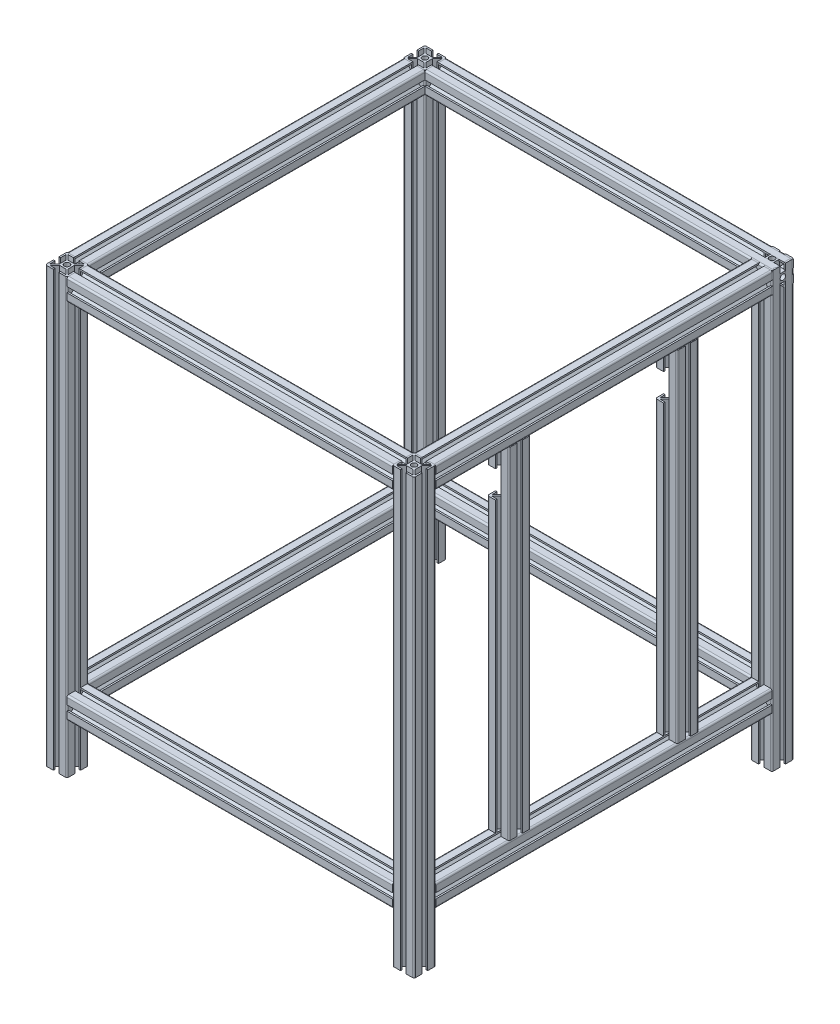
from build123d import *

# Parameters (mm, degrees)
ALUMINIUM_START                         = 20
ALUMINIUM_EXTRUSION_2020_1_OUTLINE_R    = 2.5
ALUMINIUM_EXTRUSION_2020_1_DEPTH        = 300
ALUMINIUM_EXTRUSION_2020_1_2_OUTLINE_R  = 2.5
ALUMINIUM_EXTRUSION_2020_1_2_DEPTH      = 310
ALUMINIUM_EXTRUSION_2020_1_3_OUTLINE_R  = 2.5
ALUMINIUM_EXTRUSION_2020_1_3_DEPTH      = 320
ALUMINIUM_EXTRUSION_2020_1_4_OUTLINE_R  = 2.5
ALUMINIUM_EXTRUSION_2020_1_4_DEPTH      = 310
ALUMINIUM_EXTRUSION_2020_1_5_OUTLINE_R  = 2.5
ALUMINIUM_EXTRUSION_2020_1_5_DEPTH      = 300
ALUMINIUM_EXTRUSION_2020_1_6_OUTLINE_R  = 2.5
ALUMINIUM_EXTRUSION_2020_1_6_DEPTH      = 310
ALUMINIUM_EXTRUSION_2020_1_7_OUTLINE_R  = 2.5
ALUMINIUM_EXTRUSION_2020_1_7_DEPTH      = 310
ALUMINIUM_EXTRUSION_2020_1_8_OUTLINE_R  = 2.5
ALUMINIUM_EXTRUSION_2020_1_8_DEPTH      = 300
ALUMINIUM_START_2                       = 66
ALUMINIUM_EXTRUSION_2020_1_9_OUTLINE_R  = 2.5
ALUMINIUM_EXTRUSION_2020_1_9_DEPTH      = 314
ALUMINIUM_EXTRUSION_2020_1_10_OUTLINE_R = 2.5
ALUMINIUM_EXTRUSION_2020_1_10_DEPTH     = 314
ALUMINIUM_EXTRUSION_2020_1_11_OUTLINE_R = 2.5
ALUMINIUM_EXTRUSION_2020_1_11_DEPTH     = 400
ALUMINIUM_EXTRUSION_2020_1_12_OUTLINE_R = 2.5
ALUMINIUM_EXTRUSION_2020_1_12_DEPTH     = 400
ALUMINIUM_EXTRUSION_2020_1_13_OUTLINE_R = 2.5
ALUMINIUM_EXTRUSION_2020_1_13_DEPTH     = 400
ALUMINIUM_EXTRUSION_2020_1_14_OUTLINE_R = 2.5
ALUMINIUM_EXTRUSION_2020_1_14_DEPTH     = 400
SKETCH2_W                               = 195.443565415
SKETCH2_H                               = 25
CUT_EXTRUDE1_DEPTH                      = 10


# Read off the part's stored shape, not the designer's step: Aluminium extrusion 2020(1)
with BuildPart() as part:
    # Aluminium extrusion 2020(1) outline → Aluminium extrusion 2020(1) (new body)
    with BuildSketch(Plane.YZ.offset(ALUMINIUM_START)):
        with BuildLine():
            Line((400, 331.5), (400, 337.5))
            Line((400, 337.5), (398.5, 337.5))
            Line((398.5, 337.5), (398.5, 332.560660172))
            Line((398.5, 332.560660172), (394, 337.060660172))
            Line((394, 337.060660172), (394, 342.939339828))
            Line((394, 342.939339828), (398.5, 347.439339828))
            Line((398.5, 347.439339828), (398.5, 342.5))
            Line((398.5, 342.5), (400, 342.5))
            Line((400, 342.5), (400, 348.5))
            ThreePointArc((400, 348.5), (399.560660172, 349.560660172), (398.5, 350))
            Line((398.5, 350), (392.5, 350))
            Line((392.5, 350), (392.5, 348.5))
            Line((392.5, 348.5), (397.439339828, 348.5))
            Line((397.439339828, 348.5), (392.939339828, 344))
            Line((392.939339828, 344), (387.060660172, 344))
            Line((387.060660172, 344), (382.560660172, 348.5))
            Line((382.560660172, 348.5), (387.5, 348.5))
            Line((387.5, 348.5), (387.5, 350))
            Line((387.5, 350), (381.5, 350))
            ThreePointArc((381.5, 350), (380.439339828, 349.560660172), (380, 348.5))
            Line((380, 348.5), (380, 342.5))
            Line((380, 342.5), (381.5, 342.5))
            Line((381.5, 342.5), (381.5, 347.439339828))
            Line((381.5, 347.439339828), (386, 342.939339828))
            Line((386, 342.939339828), (386, 337.060660172))
            Line((386, 337.060660172), (381.5, 332.560660172))
            Line((381.5, 332.560660172), (381.5, 337.5))
            Line((381.5, 337.5), (380, 337.5))
            Line((380, 337.5), (380, 331.5))
            ThreePointArc((380, 331.5), (380.439339828, 330.439339828), (381.5, 330))
            Line((381.5, 330), (387.5, 330))
            Line((387.5, 330), (387.5, 331.5))
            Line((387.5, 331.5), (382.560660172, 331.5))
            Line((382.560660172, 331.5), (387.060660172, 336))
            Line((387.060660172, 336), (392.939339828, 336))
            Line((392.939339828, 336), (397.439339828, 331.5))
            Line((397.439339828, 331.5), (392.5, 331.5))
            Line((392.5, 331.5), (392.5, 330))
            Line((392.5, 330), (398.5, 330))
            ThreePointArc((398.5, 330), (399.560660172, 330.439339828), (400, 331.5))
        make_face()
        with Locations((390, 340)):
            Circle(ALUMINIUM_EXTRUSION_2020_1_OUTLINE_R, mode=Mode.SUBTRACT)
    extrude(amount=ALUMINIUM_EXTRUSION_2020_1_DEPTH)


with BuildPart() as body_2:
    # Aluminium extrusion 2020_1 2 outline → Aluminium extrusion 2020_1 2 (new body)
    with BuildSketch(Plane.XY.offset(ALUMINIUM_START)):
        with BuildLine():
            Line((18.5, 400), (12.5, 400))
            Line((12.5, 400), (12.5, 398.5))
            Line((12.5, 398.5), (17.439339828, 398.5))
            Line((17.439339828, 398.5), (12.939339828, 394))
            Line((12.939339828, 394), (7.060660172, 394))
            Line((7.060660172, 394), (2.560660172, 398.5))
            Line((2.560660172, 398.5), (7.5, 398.5))
            Line((7.5, 398.5), (7.5, 400))
            Line((7.5, 400), (1.5, 400))
            ThreePointArc((1.5, 400), (0.439339828, 399.560660172), (0, 398.5))
            Line((0, 398.5), (0, 392.5))
            Line((0, 392.5), (1.5, 392.5))
            Line((1.5, 392.5), (1.5, 397.439339828))
            Line((1.5, 397.439339828), (6, 392.939339828))
            Line((6, 392.939339828), (6, 387.060660172))
            Line((6, 387.060660172), (1.5, 382.560660172))
            Line((1.5, 382.560660172), (1.5, 387.5))
            Line((1.5, 387.5), (0, 387.5))
            Line((0, 387.5), (0, 381.5))
            ThreePointArc((0, 381.5), (0.439339828, 380.439339828), (1.5, 380))
            Line((1.5, 380), (7.5, 380))
            Line((7.5, 380), (7.5, 381.5))
            Line((7.5, 381.5), (2.560660172, 381.5))
            Line((2.560660172, 381.5), (7.060660172, 386))
            Line((7.060660172, 386), (12.939339828, 386))
            Line((12.939339828, 386), (17.439339828, 381.5))
            Line((17.439339828, 381.5), (12.5, 381.5))
            Line((12.5, 381.5), (12.5, 380))
            Line((12.5, 380), (18.5, 380))
            ThreePointArc((18.5, 380), (19.560660172, 380.439339828), (20, 381.5))
            Line((20, 381.5), (20, 387.5))
            Line((20, 387.5), (18.5, 387.5))
            Line((18.5, 387.5), (18.5, 382.560660172))
            Line((18.5, 382.560660172), (14, 387.060660172))
            Line((14, 387.060660172), (14, 392.939339828))
            Line((14, 392.939339828), (18.5, 397.439339828))
            Line((18.5, 397.439339828), (18.5, 392.5))
            Line((18.5, 392.5), (20, 392.5))
            Line((20, 392.5), (20, 398.5))
            ThreePointArc((20, 398.5), (19.560660172, 399.560660172), (18.5, 400))
        make_face()
        with Locations((10, 390)):
            Circle(ALUMINIUM_EXTRUSION_2020_1_2_OUTLINE_R, mode=Mode.SUBTRACT)
    extrude(amount=ALUMINIUM_EXTRUSION_2020_1_2_DEPTH)


with BuildPart() as body_3:
    # Aluminium extrusion 2020_1 3 outline → Aluminium extrusion 2020_1 3 (new body)
    with BuildSketch(Plane.YZ.offset(ALUMINIUM_START)):
        with BuildLine():
            Line((400, 12.5), (400, 18.5))
            ThreePointArc((400, 18.5), (399.560660172, 19.560660172), (398.5, 20))
            Line((398.5, 20), (392.5, 20))
            Line((392.5, 20), (392.5, 18.5))
            Line((392.5, 18.5), (397.439339828, 18.5))
            Line((397.439339828, 18.5), (392.939339828, 14))
            Line((392.939339828, 14), (387.060660172, 14))
            Line((387.060660172, 14), (382.560660172, 18.5))
            Line((382.560660172, 18.5), (387.5, 18.5))
            Line((387.5, 18.5), (387.5, 20))
            Line((387.5, 20), (381.5, 20))
            ThreePointArc((381.5, 20), (380.439339828, 19.560660172), (380, 18.5))
            Line((380, 18.5), (380, 12.5))
            Line((380, 12.5), (381.5, 12.5))
            Line((381.5, 12.5), (381.5, 17.439339828))
            Line((381.5, 17.439339828), (386, 12.939339828))
            Line((386, 12.939339828), (386, 7.060660172))
            Line((386, 7.060660172), (381.5, 2.560660172))
            Line((381.5, 2.560660172), (381.5, 7.5))
            Line((381.5, 7.5), (380, 7.5))
            Line((380, 7.5), (380, 1.5))
            ThreePointArc((380, 1.5), (380.439339828, 0.439339828), (381.5, 0))
            Line((381.5, 0), (387.5, 0))
            Line((387.5, 0), (387.5, 1.5))
            Line((387.5, 1.5), (382.560660172, 1.5))
            Line((382.560660172, 1.5), (387.060660172, 6))
            Line((387.060660172, 6), (392.939339828, 6))
            Line((392.939339828, 6), (397.439339828, 1.5))
            Line((397.439339828, 1.5), (392.5, 1.5))
            Line((392.5, 1.5), (392.5, 0))
            Line((392.5, 0), (398.5, 0))
            ThreePointArc((398.5, 0), (399.560660172, 0.439339828), (400, 1.5))
            Line((400, 1.5), (400, 7.5))
            Line((400, 7.5), (398.5, 7.5))
            Line((398.5, 7.5), (398.5, 2.560660172))
            Line((398.5, 2.560660172), (394, 7.060660172))
            Line((394, 7.060660172), (394, 12.939339828))
            Line((394, 12.939339828), (398.5, 17.439339828))
            Line((398.5, 17.439339828), (398.5, 12.5))
            Line((398.5, 12.5), (400, 12.5))
        make_face()
        with Locations((390, 10)):
            Circle(ALUMINIUM_EXTRUSION_2020_1_3_OUTLINE_R, mode=Mode.SUBTRACT)
    extrude(amount=ALUMINIUM_EXTRUSION_2020_1_3_DEPTH)


with BuildPart() as body_4:
    # Aluminium extrusion 2020_1 4 outline → Aluminium extrusion 2020_1 4 (new body)
    with BuildSketch(Plane.XY.offset(ALUMINIUM_START)):
        with BuildLine():
            Line((327.5, 400), (321.5, 400))
            ThreePointArc((321.5, 400), (320.439339828, 399.560660172), (320, 398.5))
            Line((320, 398.5), (320, 392.5))
            Line((320, 392.5), (321.5, 392.5))
            Line((321.5, 392.5), (321.5, 397.439339828))
            Line((321.5, 397.439339828), (326, 392.939339828))
            Line((326, 392.939339828), (326, 387.060660172))
            Line((326, 387.060660172), (321.5, 382.560660172))
            Line((321.5, 382.560660172), (321.5, 387.5))
            Line((321.5, 387.5), (320, 387.5))
            Line((320, 387.5), (320, 381.5))
            ThreePointArc((320, 381.5), (320.439339828, 380.439339828), (321.5, 380))
            Line((321.5, 380), (327.5, 380))
            Line((327.5, 380), (327.5, 381.5))
            Line((327.5, 381.5), (322.560660172, 381.5))
            Line((322.560660172, 381.5), (327.060660172, 386))
            Line((327.060660172, 386), (332.939339828, 386))
            Line((332.939339828, 386), (337.439339828, 381.5))
            Line((337.439339828, 381.5), (332.5, 381.5))
            Line((332.5, 381.5), (332.5, 380))
            Line((332.5, 380), (338.5, 380))
            ThreePointArc((338.5, 380), (339.560660172, 380.439339828), (340, 381.5))
            Line((340, 381.5), (340, 387.5))
            Line((340, 387.5), (338.5, 387.5))
            Line((338.5, 387.5), (338.5, 382.560660172))
            Line((338.5, 382.560660172), (334, 387.060660172))
            Line((334, 387.060660172), (334, 392.939339828))
            Line((334, 392.939339828), (338.5, 397.439339828))
            Line((338.5, 397.439339828), (338.5, 392.5))
            Line((338.5, 392.5), (340, 392.5))
            Line((340, 392.5), (340, 398.5))
            ThreePointArc((340, 398.5), (339.560660172, 399.560660172), (338.5, 400))
            Line((338.5, 400), (332.5, 400))
            Line((332.5, 400), (332.5, 398.5))
            Line((332.5, 398.5), (337.439339828, 398.5))
            Line((337.439339828, 398.5), (332.939339828, 394))
            Line((332.939339828, 394), (327.060660172, 394))
            Line((327.060660172, 394), (322.560660172, 398.5))
            Line((322.560660172, 398.5), (327.5, 398.5))
            Line((327.5, 398.5), (327.5, 400))
        make_face()
        with Locations((330, 390)):
            Circle(ALUMINIUM_EXTRUSION_2020_1_4_OUTLINE_R, mode=Mode.SUBTRACT)
    extrude(amount=ALUMINIUM_EXTRUSION_2020_1_4_DEPTH)


with BuildPart() as body_5:
    # Aluminium extrusion 2020_1 5 outline → Aluminium extrusion 2020_1 5 (new body)
    with BuildSketch(Plane.YZ.offset(ALUMINIUM_START)):
        with BuildLine():
            ThreePointArc((66, 348.5), (65.560660172, 349.560660172), (64.5, 350))
            Line((64.5, 350), (58.5, 350))
            Line((58.5, 350), (58.5, 348.5))
            Line((58.5, 348.5), (63.439339828, 348.5))
            Line((63.439339828, 348.5), (58.939339828, 344))
            Line((58.939339828, 344), (53.060660172, 344))
            Line((53.060660172, 344), (48.560660172, 348.5))
            Line((48.560660172, 348.5), (53.5, 348.5))
            Line((53.5, 348.5), (53.5, 350))
            Line((53.5, 350), (47.5, 350))
            ThreePointArc((47.5, 350), (46.439339828, 349.560660172), (46, 348.5))
            Line((46, 348.5), (46, 342.5))
            Line((46, 342.5), (47.5, 342.5))
            Line((47.5, 342.5), (47.5, 347.439339828))
            Line((47.5, 347.439339828), (52, 342.939339828))
            Line((52, 342.939339828), (52, 337.060660172))
            Line((52, 337.060660172), (47.5, 332.560660172))
            Line((47.5, 332.560660172), (47.5, 337.5))
            Line((47.5, 337.5), (46, 337.5))
            Line((46, 337.5), (46, 331.5))
            ThreePointArc((46, 331.5), (46.439339828, 330.439339828), (47.5, 330))
            Line((47.5, 330), (53.5, 330))
            Line((53.5, 330), (53.5, 331.5))
            Line((53.5, 331.5), (48.560660172, 331.5))
            Line((48.560660172, 331.5), (53.060660172, 336))
            Line((53.060660172, 336), (58.939339828, 336))
            Line((58.939339828, 336), (63.439339828, 331.5))
            Line((63.439339828, 331.5), (58.5, 331.5))
            Line((58.5, 331.5), (58.5, 330))
            Line((58.5, 330), (64.5, 330))
            ThreePointArc((64.5, 330), (65.560660172, 330.439339828), (66, 331.5))
            Line((66, 331.5), (66, 337.5))
            Line((66, 337.5), (64.5, 337.5))
            Line((64.5, 337.5), (64.5, 332.560660172))
            Line((64.5, 332.560660172), (60, 337.060660172))
            Line((60, 337.060660172), (60, 342.939339828))
            Line((60, 342.939339828), (64.5, 347.439339828))
            Line((64.5, 347.439339828), (64.5, 342.5))
            Line((64.5, 342.5), (66, 342.5))
            Line((66, 342.5), (66, 348.5))
        make_face()
        with Locations((56, 340)):
            Circle(ALUMINIUM_EXTRUSION_2020_1_5_OUTLINE_R, mode=Mode.SUBTRACT)
    extrude(amount=ALUMINIUM_EXTRUSION_2020_1_5_DEPTH)


with BuildPart() as body_6:
    # Aluminium extrusion 2020_1 6 outline → Aluminium extrusion 2020_1 6 (new body)
    with BuildSketch(Plane.XY.offset(ALUMINIUM_START)):
        with BuildLine():
            Line((340, 58.5), (340, 64.5))
            ThreePointArc((340, 64.5), (339.560660172, 65.560660172), (338.5, 66))
            Line((338.5, 66), (332.5, 66))
            Line((332.5, 66), (332.5, 64.5))
            Line((332.5, 64.5), (337.439339828, 64.5))
            Line((337.439339828, 64.5), (332.939339828, 60))
            Line((332.939339828, 60), (327.060660172, 60))
            Line((327.060660172, 60), (322.560660172, 64.5))
            Line((322.560660172, 64.5), (327.5, 64.5))
            Line((327.5, 64.5), (327.5, 66))
            Line((327.5, 66), (321.5, 66))
            ThreePointArc((321.5, 66), (320.439339828, 65.560660172), (320, 64.5))
            Line((320, 64.5), (320, 58.5))
            Line((320, 58.5), (321.5, 58.5))
            Line((321.5, 58.5), (321.5, 63.439339828))
            Line((321.5, 63.439339828), (326, 58.939339828))
            Line((326, 58.939339828), (326, 53.060660172))
            Line((326, 53.060660172), (321.5, 48.560660172))
            Line((321.5, 48.560660172), (321.5, 53.5))
            Line((321.5, 53.5), (320, 53.5))
            Line((320, 53.5), (320, 47.5))
            ThreePointArc((320, 47.5), (320.439339828, 46.439339828), (321.5, 46))
            Line((321.5, 46), (327.5, 46))
            Line((327.5, 46), (327.5, 47.5))
            Line((327.5, 47.5), (322.560660172, 47.5))
            Line((322.560660172, 47.5), (327.060660172, 52))
            Line((327.060660172, 52), (332.939339828, 52))
            Line((332.939339828, 52), (337.439339828, 47.5))
            Line((337.439339828, 47.5), (332.5, 47.5))
            Line((332.5, 47.5), (332.5, 46))
            Line((332.5, 46), (338.5, 46))
            ThreePointArc((338.5, 46), (339.560660172, 46.439339828), (340, 47.5))
            Line((340, 47.5), (340, 53.5))
            Line((340, 53.5), (338.5, 53.5))
            Line((338.5, 53.5), (338.5, 48.560660172))
            Line((338.5, 48.560660172), (334, 53.060660172))
            Line((334, 53.060660172), (334, 58.939339828))
            Line((334, 58.939339828), (338.5, 63.439339828))
            Line((338.5, 63.439339828), (338.5, 58.5))
            Line((338.5, 58.5), (340, 58.5))
        make_face()
        with Locations((330, 56)):
            Circle(ALUMINIUM_EXTRUSION_2020_1_6_OUTLINE_R, mode=Mode.SUBTRACT)
    extrude(amount=ALUMINIUM_EXTRUSION_2020_1_6_DEPTH)


with BuildPart() as body_7:
    # Aluminium extrusion 2020_1 7 outline → Aluminium extrusion 2020_1 7 (new body)
    with BuildSketch(Plane.XY.offset(ALUMINIUM_START)):
        with BuildLine():
            ThreePointArc((1.5, 66), (0.439339828, 65.560660172), (0, 64.5))
            Line((0, 64.5), (0, 58.5))
            Line((0, 58.5), (1.5, 58.5))
            Line((1.5, 58.5), (1.5, 63.439339828))
            Line((1.5, 63.439339828), (6, 58.939339828))
            Line((6, 58.939339828), (6, 53.060660172))
            Line((6, 53.060660172), (1.5, 48.560660172))
            Line((1.5, 48.560660172), (1.5, 53.5))
            Line((1.5, 53.5), (0, 53.5))
            Line((0, 53.5), (0, 47.5))
            ThreePointArc((0, 47.5), (0.439339828, 46.439339828), (1.5, 46))
            Line((1.5, 46), (7.5, 46))
            Line((7.5, 46), (7.5, 47.5))
            Line((7.5, 47.5), (2.560660172, 47.5))
            Line((2.560660172, 47.5), (7.060660172, 52))
            Line((7.060660172, 52), (12.939339828, 52))
            Line((12.939339828, 52), (17.439339828, 47.5))
            Line((17.439339828, 47.5), (12.5, 47.5))
            Line((12.5, 47.5), (12.5, 46))
            Line((12.5, 46), (18.5, 46))
            ThreePointArc((18.5, 46), (19.560660172, 46.439339828), (20, 47.5))
            Line((20, 47.5), (20, 53.5))
            Line((20, 53.5), (18.5, 53.5))
            Line((18.5, 53.5), (18.5, 48.560660172))
            Line((18.5, 48.560660172), (14, 53.060660172))
            Line((14, 53.060660172), (14, 58.939339828))
            Line((14, 58.939339828), (18.5, 63.439339828))
            Line((18.5, 63.439339828), (18.5, 58.5))
            Line((18.5, 58.5), (20, 58.5))
            Line((20, 58.5), (20, 64.5))
            ThreePointArc((20, 64.5), (19.560660172, 65.560660172), (18.5, 66))
            Line((18.5, 66), (12.5, 66))
            Line((12.5, 66), (12.5, 64.5))
            Line((12.5, 64.5), (17.439339828, 64.5))
            Line((17.439339828, 64.5), (12.939339828, 60))
            Line((12.939339828, 60), (7.060660172, 60))
            Line((7.060660172, 60), (2.560660172, 64.5))
            Line((2.560660172, 64.5), (7.5, 64.5))
            Line((7.5, 64.5), (7.5, 66))
            Line((7.5, 66), (1.5, 66))
        make_face()
        with Locations((10, 56)):
            Circle(ALUMINIUM_EXTRUSION_2020_1_7_OUTLINE_R, mode=Mode.SUBTRACT)
    extrude(amount=ALUMINIUM_EXTRUSION_2020_1_7_DEPTH)


with BuildPart() as body_8:
    # Aluminium extrusion 2020_1 8 outline → Aluminium extrusion 2020_1 8 (new body)
    with BuildSketch(Plane.YZ.offset(ALUMINIUM_START)):
        with BuildLine():
            Line((58.5, 0), (64.5, 0))
            ThreePointArc((64.5, 0), (65.560660172, 0.439339828), (66, 1.5))
            Line((66, 1.5), (66, 7.5))
            Line((66, 7.5), (64.5, 7.5))
            Line((64.5, 7.5), (64.5, 2.560660172))
            Line((64.5, 2.560660172), (60, 7.060660172))
            Line((60, 7.060660172), (60, 12.939339828))
            Line((60, 12.939339828), (64.5, 17.439339828))
            Line((64.5, 17.439339828), (64.5, 12.5))
            Line((64.5, 12.5), (66, 12.5))
            Line((66, 12.5), (66, 18.5))
            ThreePointArc((66, 18.5), (65.560660172, 19.560660172), (64.5, 20))
            Line((64.5, 20), (58.5, 20))
            Line((58.5, 20), (58.5, 18.5))
            Line((58.5, 18.5), (63.439339828, 18.5))
            Line((63.439339828, 18.5), (58.939339828, 14))
            Line((58.939339828, 14), (53.060660172, 14))
            Line((53.060660172, 14), (48.560660172, 18.5))
            Line((48.560660172, 18.5), (53.5, 18.5))
            Line((53.5, 18.5), (53.5, 20))
            Line((53.5, 20), (47.5, 20))
            ThreePointArc((47.5, 20), (46.439339828, 19.560660172), (46, 18.5))
            Line((46, 18.5), (46, 12.5))
            Line((46, 12.5), (47.5, 12.5))
            Line((47.5, 12.5), (47.5, 17.439339828))
            Line((47.5, 17.439339828), (52, 12.939339828))
            Line((52, 12.939339828), (52, 7.060660172))
            Line((52, 7.060660172), (47.5, 2.560660172))
            Line((47.5, 2.560660172), (47.5, 7.5))
            Line((47.5, 7.5), (46, 7.5))
            Line((46, 7.5), (46, 1.5))
            ThreePointArc((46, 1.5), (46.439339828, 0.439339828), (47.5, 0))
            Line((47.5, 0), (53.5, 0))
            Line((53.5, 0), (53.5, 1.5))
            Line((53.5, 1.5), (48.560660172, 1.5))
            Line((48.560660172, 1.5), (53.060660172, 6))
            Line((53.060660172, 6), (58.939339828, 6))
            Line((58.939339828, 6), (63.439339828, 1.5))
            Line((63.439339828, 1.5), (58.5, 1.5))
            Line((58.5, 1.5), (58.5, 0))
        make_face()
        with Locations((56, 10)):
            Circle(ALUMINIUM_EXTRUSION_2020_1_8_OUTLINE_R, mode=Mode.SUBTRACT)
    extrude(amount=ALUMINIUM_EXTRUSION_2020_1_8_DEPTH)


with BuildPart() as body_9:
    # Aluminium extrusion 2020_1 9 outline → Aluminium extrusion 2020_1 9 (new body)
    with BuildSketch(Plane(origin=(0, 0, 0), x_dir=(1, 0, 0), z_dir=(0, 1, 0)).offset(ALUMINIUM_START_2)):
        with BuildLine():
            Line((321.5, -262.5), (327.5, -262.5))
            Line((327.5, -262.5), (327.5, -261))
            Line((327.5, -261), (322.560660172, -261))
            Line((322.560660172, -261), (327.060660172, -256.5))
            Line((327.060660172, -256.5), (332.939339828, -256.5))
            Line((332.939339828, -256.5), (337.439339828, -261))
            Line((337.439339828, -261), (332.5, -261))
            Line((332.5, -261), (332.5, -262.5))
            Line((332.5, -262.5), (338.5, -262.5))
            ThreePointArc((338.5, -262.5), (339.560660172, -262.060660172), (340, -261))
            Line((340, -261), (340, -255))
            Line((340, -255), (338.5, -255))
            Line((338.5, -255), (338.5, -259.939339828))
            Line((338.5, -259.939339828), (334, -255.439339828))
            Line((334, -255.439339828), (334, -249.560660172))
            Line((334, -249.560660172), (338.5, -245.060660172))
            Line((338.5, -245.060660172), (338.5, -250))
            Line((338.5, -250), (340, -250))
            Line((340, -250), (340, -244))
            ThreePointArc((340, -244), (339.560660172, -242.939339828), (338.5, -242.5))
            Line((338.5, -242.5), (332.5, -242.5))
            Line((332.5, -242.5), (332.5, -244))
            Line((332.5, -244), (337.439339828, -244))
            Line((337.439339828, -244), (332.939339828, -248.5))
            Line((332.939339828, -248.5), (327.060660172, -248.5))
            Line((327.060660172, -248.5), (322.560660172, -244))
            Line((322.560660172, -244), (327.5, -244))
            Line((327.5, -244), (327.5, -242.5))
            Line((327.5, -242.5), (321.5, -242.5))
            ThreePointArc((321.5, -242.5), (320.439339828, -242.939339828), (320, -244))
            Line((320, -244), (320, -250))
            Line((320, -250), (321.5, -250))
            Line((321.5, -250), (321.5, -245.060660172))
            Line((321.5, -245.060660172), (326, -249.560660172))
            Line((326, -249.560660172), (326, -255.439339828))
            Line((326, -255.439339828), (321.5, -259.939339828))
            Line((321.5, -259.939339828), (321.5, -255))
            Line((321.5, -255), (320, -255))
            Line((320, -255), (320, -261))
            ThreePointArc((320, -261), (320.439339828, -262.060660172), (321.5, -262.5))
        make_face()
        with Locations((330, -252.5)):
            Circle(ALUMINIUM_EXTRUSION_2020_1_9_OUTLINE_R, mode=Mode.SUBTRACT)
    extrude(amount=ALUMINIUM_EXTRUSION_2020_1_9_DEPTH)


with BuildPart() as body_10:
    # Aluminium extrusion 2020_1 10 outline → Aluminium extrusion 2020_1 10 (new body)
    with BuildSketch(Plane(origin=(0, 0, 0), x_dir=(1, 0, 0), z_dir=(0, 1, 0)).offset(ALUMINIUM_START_2)):
        with BuildLine():
            Line((321.5, -107.5), (327.5, -107.5))
            Line((327.5, -107.5), (327.5, -106))
            Line((327.5, -106), (322.560660172, -106))
            Line((322.560660172, -106), (327.060660172, -101.5))
            Line((327.060660172, -101.5), (332.939339828, -101.5))
            Line((332.939339828, -101.5), (337.439339828, -106))
            Line((337.439339828, -106), (332.5, -106))
            Line((332.5, -106), (332.5, -107.5))
            Line((332.5, -107.5), (338.5, -107.5))
            ThreePointArc((338.5, -107.5), (339.560660172, -107.060660172), (340, -106))
            Line((340, -106), (340, -100))
            Line((340, -100), (338.5, -100))
            Line((338.5, -100), (338.5, -104.939339828))
            Line((338.5, -104.939339828), (334, -100.439339828))
            Line((334, -100.439339828), (334, -94.560660172))
            Line((334, -94.560660172), (338.5, -90.060660172))
            Line((338.5, -90.060660172), (338.5, -95))
            Line((338.5, -95), (340, -95))
            Line((340, -95), (340, -89))
            ThreePointArc((340, -89), (339.560660172, -87.939339828), (338.5, -87.5))
            Line((338.5, -87.5), (332.5, -87.5))
            Line((332.5, -87.5), (332.5, -89))
            Line((332.5, -89), (337.439339828, -89))
            Line((337.439339828, -89), (332.939339828, -93.5))
            Line((332.939339828, -93.5), (327.060660172, -93.5))
            Line((327.060660172, -93.5), (322.560660172, -89))
            Line((322.560660172, -89), (327.5, -89))
            Line((327.5, -89), (327.5, -87.5))
            Line((327.5, -87.5), (321.5, -87.5))
            ThreePointArc((321.5, -87.5), (320.439339828, -87.939339828), (320, -89))
            Line((320, -89), (320, -95))
            Line((320, -95), (321.5, -95))
            Line((321.5, -95), (321.5, -90.060660172))
            Line((321.5, -90.060660172), (326, -94.560660172))
            Line((326, -94.560660172), (326, -100.439339828))
            Line((326, -100.439339828), (321.5, -104.939339828))
            Line((321.5, -104.939339828), (321.5, -100))
            Line((321.5, -100), (320, -100))
            Line((320, -100), (320, -106))
            ThreePointArc((320, -106), (320.439339828, -107.060660172), (321.5, -107.5))
        make_face()
        with Locations((330, -97.5)):
            Circle(ALUMINIUM_EXTRUSION_2020_1_10_OUTLINE_R, mode=Mode.SUBTRACT)
    extrude(amount=ALUMINIUM_EXTRUSION_2020_1_10_DEPTH)


with BuildPart() as body_11:
    # Aluminium extrusion 2020_1 11 outline → Aluminium extrusion 2020_1 11 (new body)
    with BuildSketch(Plane(origin=(0, 0, 0), x_dir=(1, 0, 0), z_dir=(0, 1, 0))):
        with BuildLine():
            Line((0, -12.5), (0, -18.5))
            ThreePointArc((0, -18.5), (0.439339828, -19.560660172), (1.5, -20))
            Line((1.5, -20), (7.5, -20))
            Line((7.5, -20), (7.5, -18.5))
            Line((7.5, -18.5), (2.560660172, -18.5))
            Line((2.560660172, -18.5), (7.060660172, -14))
            Line((7.060660172, -14), (12.939339828, -14))
            Line((12.939339828, -14), (17.439339828, -18.5))
            Line((17.439339828, -18.5), (12.5, -18.5))
            Line((12.5, -18.5), (12.5, -20))
            Line((12.5, -20), (18.5, -20))
            ThreePointArc((18.5, -20), (19.560660172, -19.560660172), (20, -18.5))
            Line((20, -18.5), (20, -12.5))
            Line((20, -12.5), (18.5, -12.5))
            Line((18.5, -12.5), (18.5, -17.439339828))
            Line((18.5, -17.439339828), (14, -12.939339828))
            Line((14, -12.939339828), (14, -7.060660172))
            Line((14, -7.060660172), (18.5, -2.560660172))
            Line((18.5, -2.560660172), (18.5, -7.5))
            Line((18.5, -7.5), (20, -7.5))
            Line((20, -7.5), (20, -1.5))
            ThreePointArc((20, -1.5), (19.560660172, -0.439339828), (18.5, 0))
            Line((18.5, 0), (12.5, 0))
            Line((12.5, 0), (12.5, -1.5))
            Line((12.5, -1.5), (17.439339828, -1.5))
            Line((17.439339828, -1.5), (12.939339828, -6))
            Line((12.939339828, -6), (7.060660172, -6))
            Line((7.060660172, -6), (2.560660172, -1.5))
            Line((2.560660172, -1.5), (7.5, -1.5))
            Line((7.5, -1.5), (7.5, 0))
            Line((7.5, 0), (1.5, 0))
            ThreePointArc((1.5, 0), (0.439339828, -0.439339828), (0, -1.5))
            Line((0, -1.5), (0, -7.5))
            Line((0, -7.5), (1.5, -7.5))
            Line((1.5, -7.5), (1.5, -2.560660172))
            Line((1.5, -2.560660172), (6, -7.060660172))
            Line((6, -7.060660172), (6, -12.939339828))
            Line((6, -12.939339828), (1.5, -17.439339828))
            Line((1.5, -17.439339828), (1.5, -12.5))
            Line((1.5, -12.5), (0, -12.5))
        make_face()
        with Locations((10, -10)):
            Circle(ALUMINIUM_EXTRUSION_2020_1_11_OUTLINE_R, mode=Mode.SUBTRACT)
    extrude(amount=ALUMINIUM_EXTRUSION_2020_1_11_DEPTH)


with BuildPart() as body_12:
    # Aluminium extrusion 2020_1 12 outline → Aluminium extrusion 2020_1 12 (new body)
    with BuildSketch(Plane(origin=(0, 0, 0), x_dir=(1, 0, 0), z_dir=(0, 1, 0))):
        with BuildLine():
            ThreePointArc((321.5, -330), (320.439339828, -330.439339828), (320, -331.5))
            Line((320, -331.5), (320, -337.5))
            Line((320, -337.5), (321.5, -337.5))
            Line((321.5, -337.5), (321.5, -332.560660172))
            Line((321.5, -332.560660172), (326, -337.060660172))
            Line((326, -337.060660172), (326, -342.939339828))
            Line((326, -342.939339828), (321.5, -347.439339828))
            Line((321.5, -347.439339828), (321.5, -342.5))
            Line((321.5, -342.5), (320, -342.5))
            Line((320, -342.5), (320, -348.5))
            ThreePointArc((320, -348.5), (320.439339828, -349.560660172), (321.5, -350))
            Line((321.5, -350), (327.5, -350))
            Line((327.5, -350), (327.5, -348.5))
            Line((327.5, -348.5), (322.560660172, -348.5))
            Line((322.560660172, -348.5), (327.060660172, -344))
            Line((327.060660172, -344), (332.939339828, -344))
            Line((332.939339828, -344), (337.439339828, -348.5))
            Line((337.439339828, -348.5), (332.5, -348.5))
            Line((332.5, -348.5), (332.5, -350))
            Line((332.5, -350), (338.5, -350))
            ThreePointArc((338.5, -350), (339.560660172, -349.560660172), (340, -348.5))
            Line((340, -348.5), (340, -342.5))
            Line((340, -342.5), (338.5, -342.5))
            Line((338.5, -342.5), (338.5, -347.439339828))
            Line((338.5, -347.439339828), (334, -342.939339828))
            Line((334, -342.939339828), (334, -337.060660172))
            Line((334, -337.060660172), (338.5, -332.560660172))
            Line((338.5, -332.560660172), (338.5, -337.5))
            Line((338.5, -337.5), (340, -337.5))
            Line((340, -337.5), (340, -331.5))
            ThreePointArc((340, -331.5), (339.560660172, -330.439339828), (338.5, -330))
            Line((338.5, -330), (332.5, -330))
            Line((332.5, -330), (332.5, -331.5))
            Line((332.5, -331.5), (337.439339828, -331.5))
            Line((337.439339828, -331.5), (332.939339828, -336))
            Line((332.939339828, -336), (327.060660172, -336))
            Line((327.060660172, -336), (322.560660172, -331.5))
            Line((322.560660172, -331.5), (327.5, -331.5))
            Line((327.5, -331.5), (327.5, -330))
            Line((327.5, -330), (321.5, -330))
        make_face()
        with Locations((330, -340)):
            Circle(ALUMINIUM_EXTRUSION_2020_1_12_OUTLINE_R, mode=Mode.SUBTRACT)
    extrude(amount=ALUMINIUM_EXTRUSION_2020_1_12_DEPTH)


with BuildPart() as body_13:
    # Aluminium extrusion 2020_1 13 outline → Aluminium extrusion 2020_1 13 (new body)
    with BuildSketch(Plane(origin=(0, 0, 0), x_dir=(1, 0, 0), z_dir=(0, 1, 0))):
        with BuildLine():
            ThreePointArc((321.5, 0), (320.439339828, -0.439339828), (320, -1.5))
            Line((320, -1.5), (320, -7.5))
            Line((320, -7.5), (321.5, -7.5))
            Line((321.5, -7.5), (321.5, -2.560660172))
            Line((321.5, -2.560660172), (326, -7.060660172))
            Line((326, -7.060660172), (326, -12.939339828))
            Line((326, -12.939339828), (321.5, -17.439339828))
            Line((321.5, -17.439339828), (321.5, -12.5))
            Line((321.5, -12.5), (320, -12.5))
            Line((320, -12.5), (320, -18.5))
            ThreePointArc((320, -18.5), (320.439339828, -19.560660172), (321.5, -20))
            Line((321.5, -20), (327.5, -20))
            Line((327.5, -20), (327.5, -18.5))
            Line((327.5, -18.5), (322.560660172, -18.5))
            Line((322.560660172, -18.5), (327.060660172, -14))
            Line((327.060660172, -14), (332.939339828, -14))
            Line((332.939339828, -14), (337.439339828, -18.5))
            Line((337.439339828, -18.5), (332.5, -18.5))
            Line((332.5, -18.5), (332.5, -20))
            Line((332.5, -20), (338.5, -20))
            ThreePointArc((338.5, -20), (339.560660172, -19.560660172), (340, -18.5))
            Line((340, -18.5), (340, -12.5))
            Line((340, -12.5), (338.5, -12.5))
            Line((338.5, -12.5), (338.5, -17.439339828))
            Line((338.5, -17.439339828), (334, -12.939339828))
            Line((334, -12.939339828), (334, -7.060660172))
            Line((334, -7.060660172), (338.5, -2.560660172))
            Line((338.5, -2.560660172), (338.5, -7.5))
            Line((338.5, -7.5), (340, -7.5))
            Line((340, -7.5), (340, -1.5))
            ThreePointArc((340, -1.5), (339.560660172, -0.439339828), (338.5, 0))
            Line((338.5, 0), (332.5, 0))
            Line((332.5, 0), (332.5, -1.5))
            Line((332.5, -1.5), (337.439339828, -1.5))
            Line((337.439339828, -1.5), (332.939339828, -6))
            Line((332.939339828, -6), (327.060660172, -6))
            Line((327.060660172, -6), (322.560660172, -1.5))
            Line((322.560660172, -1.5), (327.5, -1.5))
            Line((327.5, -1.5), (327.5, 0))
            Line((327.5, 0), (321.5, 0))
        make_face()
        with Locations((330, -10)):
            Circle(ALUMINIUM_EXTRUSION_2020_1_13_OUTLINE_R, mode=Mode.SUBTRACT)
    extrude(amount=ALUMINIUM_EXTRUSION_2020_1_13_DEPTH)


with BuildPart() as body_14:
    # Aluminium extrusion 2020_1 14 outline → Aluminium extrusion 2020_1 14 (new body)
    with BuildSketch(Plane(origin=(0, 0, 0), x_dir=(1, 0, 0), z_dir=(0, 1, 0))):
        with BuildLine():
            Line((0, -342.5), (0, -348.5))
            ThreePointArc((0, -348.5), (0.439339828, -349.560660172), (1.5, -350))
            Line((1.5, -350), (7.5, -350))
            Line((7.5, -350), (7.5, -348.5))
            Line((7.5, -348.5), (2.560660172, -348.5))
            Line((2.560660172, -348.5), (7.060660172, -344))
            Line((7.060660172, -344), (12.939339828, -344))
            Line((12.939339828, -344), (17.439339828, -348.5))
            Line((17.439339828, -348.5), (12.5, -348.5))
            Line((12.5, -348.5), (12.5, -350))
            Line((12.5, -350), (18.5, -350))
            ThreePointArc((18.5, -350), (19.560660172, -349.560660172), (20, -348.5))
            Line((20, -348.5), (20, -342.5))
            Line((20, -342.5), (18.5, -342.5))
            Line((18.5, -342.5), (18.5, -347.439339828))
            Line((18.5, -347.439339828), (14, -342.939339828))
            Line((14, -342.939339828), (14, -337.060660172))
            Line((14, -337.060660172), (18.5, -332.560660172))
            Line((18.5, -332.560660172), (18.5, -337.5))
            Line((18.5, -337.5), (20, -337.5))
            Line((20, -337.5), (20, -331.5))
            ThreePointArc((20, -331.5), (19.560660172, -330.439339828), (18.5, -330))
            Line((18.5, -330), (12.5, -330))
            Line((12.5, -330), (12.5, -331.5))
            Line((12.5, -331.5), (17.439339828, -331.5))
            Line((17.439339828, -331.5), (12.939339828, -336))
            Line((12.939339828, -336), (7.060660172, -336))
            Line((7.060660172, -336), (2.560660172, -331.5))
            Line((2.560660172, -331.5), (7.5, -331.5))
            Line((7.5, -331.5), (7.5, -330))
            Line((7.5, -330), (1.5, -330))
            ThreePointArc((1.5, -330), (0.439339828, -330.439339828), (0, -331.5))
            Line((0, -331.5), (0, -337.5))
            Line((0, -337.5), (1.5, -337.5))
            Line((1.5, -337.5), (1.5, -332.560660172))
            Line((1.5, -332.560660172), (6, -337.060660172))
            Line((6, -337.060660172), (6, -342.939339828))
            Line((6, -342.939339828), (1.5, -347.439339828))
            Line((1.5, -347.439339828), (1.5, -342.5))
            Line((1.5, -342.5), (0, -342.5))
        make_face()
        with Locations((10, -340)):
            Circle(ALUMINIUM_EXTRUSION_2020_1_14_OUTLINE_R, mode=Mode.SUBTRACT)
    extrude(amount=ALUMINIUM_EXTRUSION_2020_1_14_DEPTH)


with BuildPart() as cut_extrude1_tool:
    # Sketch2 → Cut-Extrude1 (new body)
    with BuildSketch(Plane.ZY.offset(-320)):
        with Locations((176.021865415, 344.5)):
            Rectangle(SKETCH2_W, SKETCH2_H)
    extrude(amount=-CUT_EXTRUDE1_DEPTH)


with BuildPart() as body_9_1:
    add(body_9.part)

    # Cut-Extrude1: cut by cut_extrude1_tool
    add(cut_extrude1_tool.part, mode=Mode.SUBTRACT)


with BuildPart() as body_10_1:
    add(body_10.part)

    # Cut-Extrude1: cut by cut_extrude1_tool
    add(cut_extrude1_tool.part, mode=Mode.SUBTRACT)


solid = Compound([part.part, body_2.part, body_3.part, body_4.part, body_5.part, body_6.part, body_7.part, body_8.part, body_11.part, body_12.part, body_13.part, body_14.part, body_9_1.part, body_10_1.part])
